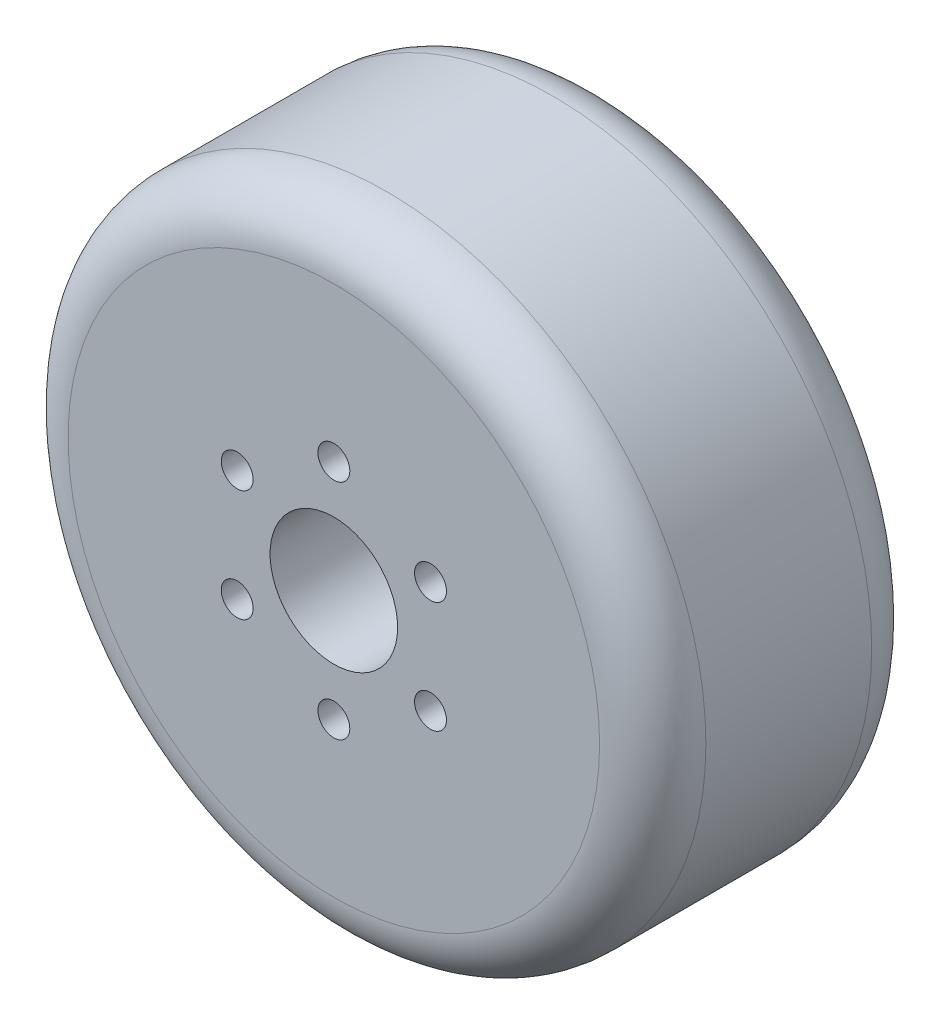
from build123d import *

# Parameters (mm, degrees)
SKETCH_1_R               = 30
SKETCH_1_R_2             = 6
EXTRUDE_1_DEPTH          = 25.6
FILLET_2_R               = 5
SKETCH_3_R               = 1.5
CUT_EXTRUDE_1_DEPTH      = 50.551589339
PATTERN_CIRCULAR_2_COUNT = 6


with BuildPart() as part:
    # ｽｹｯﾁ1 → ﾎﾞｽ - 押し出し1 (new body)
    with BuildSketch(Plane.XY):
        Circle(SKETCH_1_R)
        Circle(SKETCH_1_R_2, mode=Mode.SUBTRACT)
    extrude(amount=EXTRUDE_1_DEPTH)

    # ﾌｨﾚｯﾄ2
    fillet_2_edges = [part.edges().sort_by_distance(p)[0] for p in [
        (-30, 0, 25.6),
        (-30, 0, 0),
    ]]
    fillet(fillet_2_edges, radius=FILLET_2_R)

    # ｽｹｯﾁ3 → ｶｯﾄ - 押し出し1 (cut, through all)
    with BuildSketch(Plane(origin=(0, 0, 0), x_dir=(-1, 0, 0), z_dir=(0, 0, -1))):
        with Locations((0, 10.5)):
            Circle(SKETCH_3_R)
    cut_extrude_1 = extrude(amount=-CUT_EXTRUDE_1_DEPTH, mode=Mode.SUBTRACT)

    # 円形ﾊﾟﾀｰﾝ2: ｶｯﾄ - 押し出し1 ×6 about axis
    pattern_circular_2_axis = Axis((0, 0, 25.6), (0, 0, -1))
    for i in range(1, PATTERN_CIRCULAR_2_COUNT):
        add(cut_extrude_1.rotate(pattern_circular_2_axis, i * 360 / PATTERN_CIRCULAR_2_COUNT), mode=Mode.SUBTRACT)


solid = part.part
